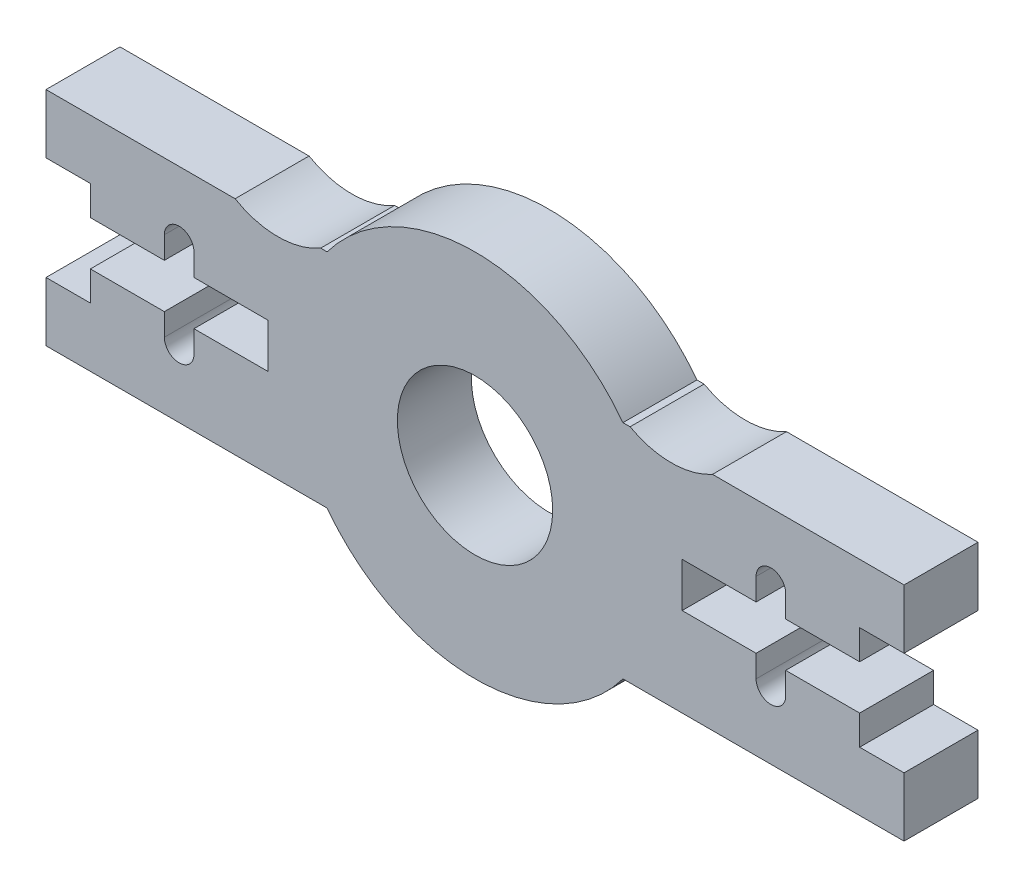
from build123d import *

# Parameters (mm, degrees)
BOSS_EXTRUDE1_DEPTH = 5
SKETCH2_R           = 5.25
CUT_EXTRUDE1_DEPTH  = 5
SKETCH3_3_R         = 5.75
CUT_EXTRUDE2_DEPTH  = 10
SKETCH4_W           = 3
SKETCH4_H           = 4
BOSS_EXTRUDE3_DEPTH = 5


with BuildPart() as part:
    # Sketch1 → Boss-Extrude1 (new body)
    with BuildSketch(Plane.XY):
        with BuildLine():
            Line((10, -7.5), (26, -7.5))
            Line((26, -7.5), (26, -1.5))
            Line((26, -1.5), (21, -1.5))
            Line((21, -1.5), (21, -3))
            ThreePointArc((21, -3), (20, -4), (19, -3))
            Line((19, -3), (19, -1.5))
            Line((19, -1.5), (14, -1.5))
            Line((14, -1.5), (14, 1.5))
            Line((14, 1.5), (19, 1.5))
            Line((19, 1.5), (19, 3))
            ThreePointArc((19, 3), (20, 4), (21, 3))
            Line((21, 3), (21, 1.5))
            Line((21, 1.5), (26, 1.5))
            Line((26, 1.5), (26, 7.5))
            Line((26, 7.5), (10, 7.5))
            ThreePointArc((10, 7.5), (0, 12.5), (-10, 7.5))
            Line((-10, 7.5), (-26, 7.5))
            Line((-26, 7.5), (-26, 1.5))
            Line((-26, 1.5), (-21, 1.5))
            Line((-21, 1.5), (-21, 3))
            ThreePointArc((-21, 3), (-20, 4), (-19, 3))
            Line((-19, 3), (-19, 1.5))
            Line((-19, 1.5), (-14, 1.5))
            Line((-14, 1.5), (-14, -1.5))
            Line((-14, -1.5), (-19, -1.5))
            Line((-19, -1.5), (-19, -3))
            ThreePointArc((-19, -3), (-20, -4), (-21, -3))
            Line((-21, -3), (-21, -1.5))
            Line((-21, -1.5), (-26, -1.5))
            Line((-26, -1.5), (-26, -7.5))
            Line((-26, -7.5), (-10, -7.5))
            ThreePointArc((-10, -7.5), (0, -12.5), (10, -7.5))
        make_face()
    extrude(amount=BOSS_EXTRUDE1_DEPTH)

    # Sketch2 → Cut-Extrude1 (cut)
    with BuildSketch(Plane.XY.offset(5)):
        Circle(SKETCH2_R)
    extrude(amount=-CUT_EXTRUDE1_DEPTH, mode=Mode.SUBTRACT)

    # Sketch3<3> → Cut-Extrude2 (cut)
    with BuildSketch(Plane.XY.offset(5)):
        with Locations((-13.325781182, 12.469404793)):
            Circle(SKETCH3_3_R)
        with Locations((13.268320868, 12.530529173)):
            Circle(SKETCH3_3_R)
    extrude(amount=-CUT_EXTRUDE2_DEPTH, mode=Mode.SUBTRACT)

    # Sketch4 → Boss-Extrude3 (add)
    with BuildSketch(Plane.XY.offset(5)):
        with Locations((-27.5, 5.5)):
            Rectangle(SKETCH4_W, SKETCH4_H)
        with Locations((-27.5, -5.5)):
            Rectangle(SKETCH4_W, SKETCH4_H)
    boss_extrude3 = extrude(amount=-BOSS_EXTRUDE3_DEPTH)

    # Mirror1: Boss-Extrude3 across plane
    add(boss_extrude3.mirror(Plane(origin=(0, 0, 0), x_dir=(0, 0, 1), z_dir=(1, 0, 0))))


solid = part.part
